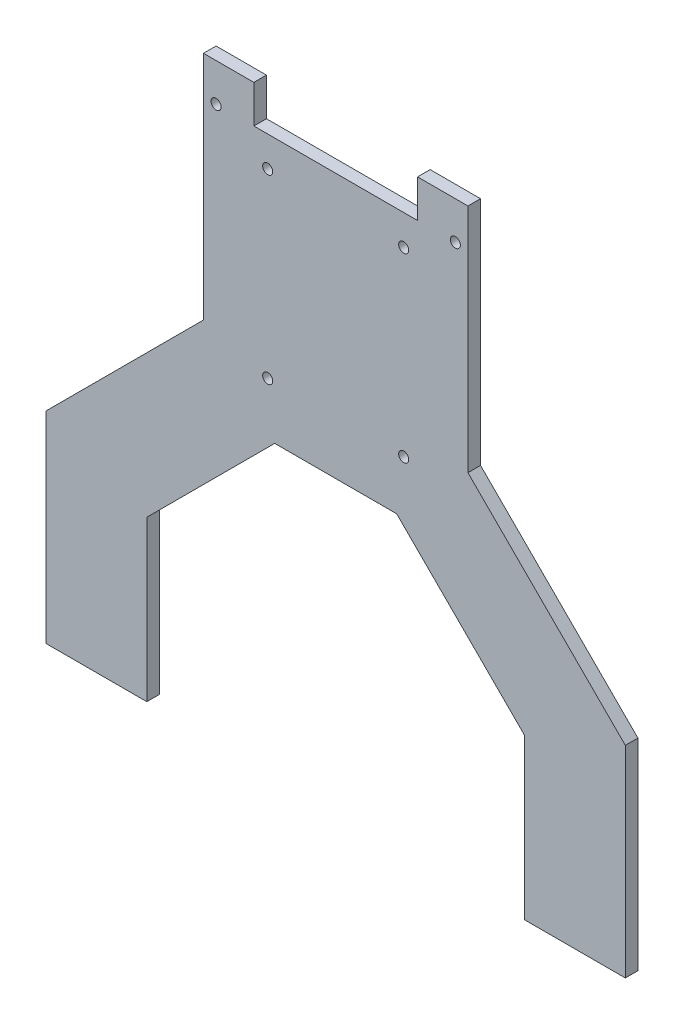
from build123d import *

# Parameters (mm, degrees)
SKETCH1_R           = 2
BOSS_EXTRUDE1_DEPTH = 5
BOSS_EXTRUDE2_DEPTH = 5


with BuildPart() as part:
    # Sketch1 → Boss-Extrude1 (new body)
    with BuildSketch(Plane.XY):
        Polygon((-32.5, 60), (-52.5, 60), (-52.5, -60), (52.5, -60), (52.5, 60), (32.5, 60), (32.5, 45), (-32.5, 45), align=None)
        with Locations((-27, -39)):
            Circle(SKETCH1_R, mode=Mode.SUBTRACT)
        with Locations((27, -39)):
            Circle(SKETCH1_R, mode=Mode.SUBTRACT)
        with Locations((-27, 33)):
            Circle(SKETCH1_R, mode=Mode.SUBTRACT)
        with Locations((-47.5, 45)):
            Circle(SKETCH1_R, mode=Mode.SUBTRACT)
        with Locations((27, 33)):
            Circle(SKETCH1_R, mode=Mode.SUBTRACT)
        with Locations((47.5, 45)):
            Circle(SKETCH1_R, mode=Mode.SUBTRACT)
    extrude(amount=BOSS_EXTRUDE1_DEPTH)

    # Sketch2 → Boss-Extrude2 (add)
    with BuildSketch(Plane.XY):
        Polygon((-24.215724685, -60), (-52.5, -31.715724685), (-115, -94.215728753), (-115, -174.215728753), (-75, -174.215728753), (-75, -110.78427201), align=None)
    boss_extrude2 = extrude(amount=BOSS_EXTRUDE2_DEPTH)

    # Mirror1: Boss-Extrude2 across plane
    add(boss_extrude2.mirror(Plane(origin=(0, 0, 0), x_dir=(0, 0, 1), z_dir=(1, 0, 0))))


solid = part.part
